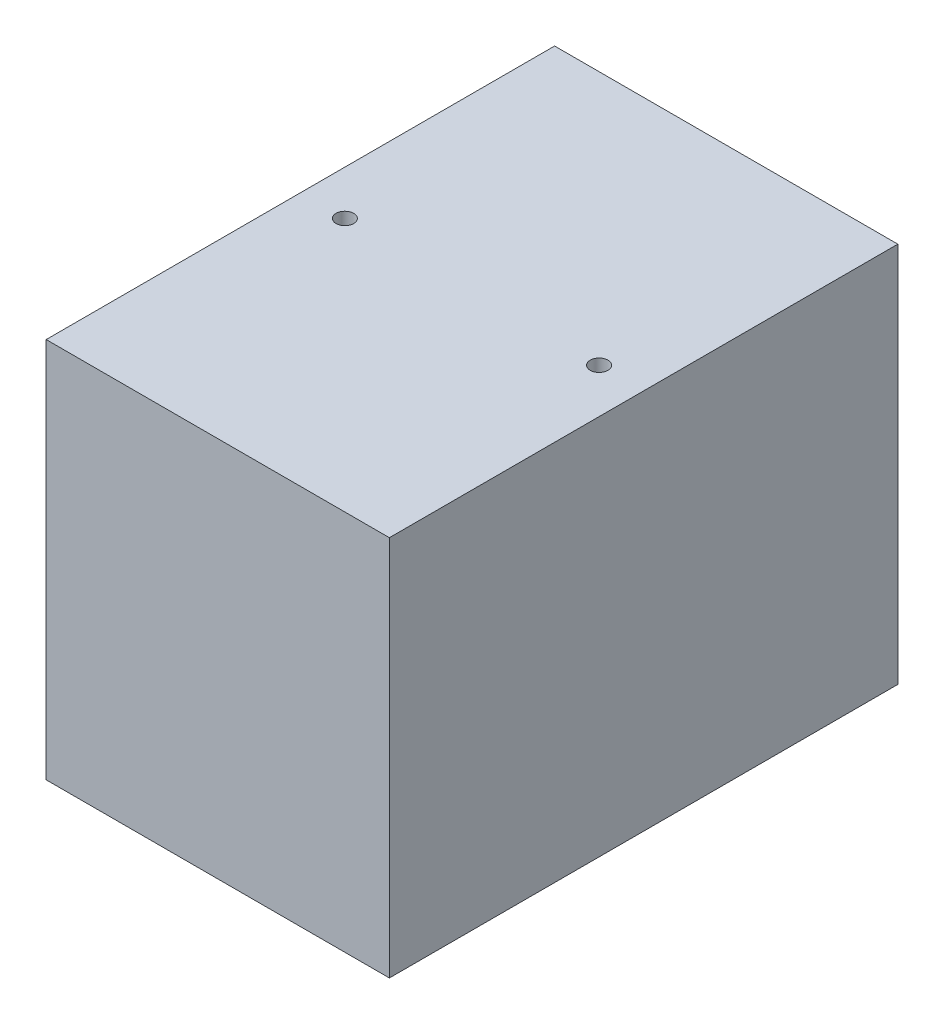
from build123d import *

# Parameters (mm, degrees)
BOSS_EXTRUDE1_DEPTH               = 34.29
F_1_4_20_TAPPED_HOLE1_D           = 5.1054
F_1_4_20_TAPPED_HOLE1_DEPTH       = 16.51
F_1_4_20_TAPPED_HOLE1_CSINK_D     = 6.3754
F_1_4_20_TAPPED_HOLE1_CSINK_ANGLE = 90
F_1_4_20_TAPPED_HOLE1_TIP         = 1.533816902
SKETCH11_W                        = 14.690046345
SKETCH11_H                        = 2.54
BOSS_EXTRUDE3_DEPTH               = 34.29
SKETCH10_R                        = 9.703139682
BOSS_EXTRUDE4_DEPTH               = 34.29
SKETCH13_R                        = 0.884999144
CUT_EXTRUDE2_DEPTH                = 1.524


with BuildPart() as part:
    # Sketch2 → Boss-Extrude1 (new body)
    with BuildSketch(Plane(origin=(0, 0, 0), x_dir=(0, 0, -1), z_dir=(1, 0, 0))):
        with BuildLine():
            Line((0, 0), (50.8, 0))
            Line((50.8, 0), (50.8, 17.78))
            Line((50.8, 17.78), (36.109953655, 17.78))
            ThreePointArc((36.109953655, 17.78), (17.145, 19.05), (36.109953655, 20.32))
            Line((36.109953655, 20.32), (50.8, 20.32))
            Line((50.8, 20.32), (50.8, 38.1))
            Line((50.8, 38.1), (0, 38.1))
            Line((0, 38.1), (0, 0))
        make_face()
    extrude(amount=BOSS_EXTRUDE1_DEPTH)

    # 1/4-20 Tapped Hole1
    with Locations(Plane(origin=(0, 0, 0), x_dir=(-1, 0, 0), z_dir=(0, -1, 0))):
        with Locations((-17.145, 12.7), (-17.145, 38.1)):
            CounterSinkHole(F_1_4_20_TAPPED_HOLE1_D / 2, F_1_4_20_TAPPED_HOLE1_CSINK_D / 2, depth=F_1_4_20_TAPPED_HOLE1_DEPTH, counter_sink_angle=F_1_4_20_TAPPED_HOLE1_CSINK_ANGLE)
            with Locations((0, 0, -(F_1_4_20_TAPPED_HOLE1_DEPTH + F_1_4_20_TAPPED_HOLE1_TIP / 2))):  # 118° drill point
                Cone(0, F_1_4_20_TAPPED_HOLE1_D / 2, F_1_4_20_TAPPED_HOLE1_TIP, mode=Mode.SUBTRACT)

    # Sketch11 → Boss-Extrude3 (add)
    with BuildSketch(Plane.ZY):
        with Locations((-43.454976828, 19.05)):
            Rectangle(SKETCH11_W, SKETCH11_H)
    extrude(amount=-BOSS_EXTRUDE3_DEPTH)

    # Sketch10 → Boss-Extrude4 (add)
    with BuildSketch(Plane(origin=(0, -2.659795234, 0), x_dir=(0, 0, 1), z_dir=(-1, 0, 0))):
        with Locations((-26.802286556, 21.590488848)):
            Circle(SKETCH10_R)
    extrude(amount=-BOSS_EXTRUDE4_DEPTH)

    # Sketch13 → Cut-Extrude2 (cut)
    with BuildSketch(Plane(origin=(0, 38.1, 0), x_dir=(1, 0, 0), z_dir=(0, 1, 0))):
        with Locations((4.445, 25.4)):
            Circle(SKETCH13_R)
        with Locations((29.845, 25.4)):
            Circle(SKETCH13_R)
    extrude(amount=-CUT_EXTRUDE2_DEPTH, mode=Mode.SUBTRACT)


solid = part.part
